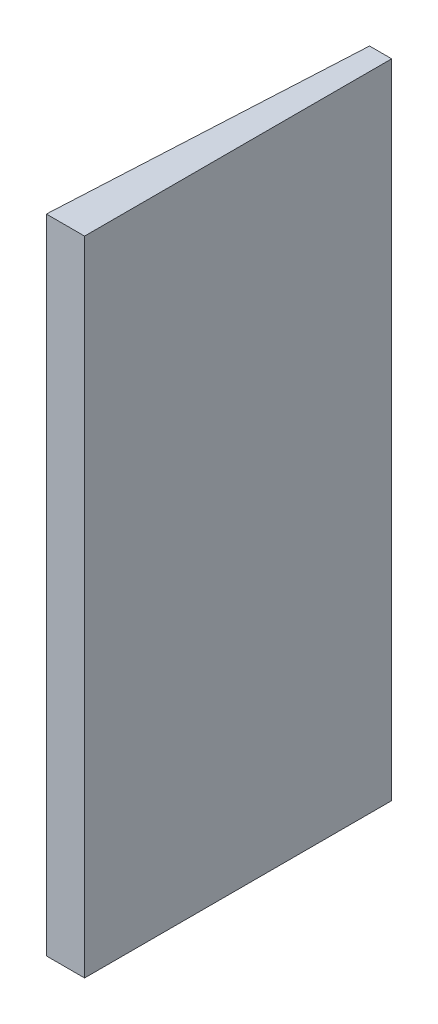
from build123d import *

# Parameters (mm, degrees)
BOSS_EXTRUDE1_DEPTH = 42
SKETCH3_7_R         = 3.3
SKETCH2_6_R         = 6.3


with BuildPart() as part:
    # Sketch1 → Boss-Extrude1 (new, symmetric)
    with BuildSketch(Plane(origin=(0, 0, 0), x_dir=(1, 0, 0), z_dir=(0, 1, 0))):
        Polygon((0, 20.057673142), (0, -20.092326858), (-5, -20.092326858), (-2.895827662, 20.057673142), align=None)
    extrude(amount=BOSS_EXTRUDE1_DEPTH, both=True)

    # Loft2: read off the stored shape, not the designer's step
    # Loft2: loft between two sections, ruled curve by curve
    loft2_from = [
        Edge.make_bspline([(-6.744919191, -26.766256905, -3.934599382), (-7.072478945, -28.860904588, 2.315613069), (-6.962853556, -35.119694494, 0.223836028), (-6.635293801, -33.025046811, -6.026376424), (-6.307734047, -30.930399127, -12.276588875), (-6.417359436, -24.671609222, -10.184811834), (-6.744919191, -26.766256905, -3.934599382)], [0, 0, 0, 0, 0.5, 0.5, 0.5, 1, 1, 1, 1], 3, [1, 0.333333333, 0.333333333, 1, 0.333333333, 0.333333333, 1]),
    ]
    loft2_to = [
        Edge.make_bspline([(-3.874025978, -24.614903671, -1.39253736), (-4.42677199, -31.486205901, 9.154484851), (-4.067155817, -42.047702275, 2.292599502), (-3.514409805, -35.176400045, -8.254422709), (-2.961663793, -28.305097815, -18.801444919), (-3.321279966, -17.743601441, -11.93955957), (-3.874025978, -24.614903671, -1.39253736)], [0, 0, 0, 0, 0.5, 0.5, 0.5, 1, 1, 1, 1], 3, [1, 0.333333333, 0.333333333, 1, 0.333333333, 0.333333333, 1]),
    ]
    loft2 = Solid(Shell([*[Face.make_surface_from_curves(loft2_from[k], loft2_to[k]) for k in range(1)], Face(Wire(loft2_from)), Face(Wire(loft2_to))]))
    add(loft2)

    # Sketch3<7> → Loft3 section 0
    with BuildSketch(Plane(origin=(-6.932083318, 0, -0.363295092), x_dir=(-0.052335956242940435, 0, 0.998629534754574), z_dir=(-0.9986295347545742, 0, -0.052335956242940435))):
        with Locations((-4.623529197, 29.895651858)):
            Circle(SKETCH3_7_R)
    # Sketch2<6> → Loft3 section 1
    with BuildSketch(Plane(origin=(-3.936194713, 0, -0.206287224), x_dir=(-0.052335956242940435, 0, 0.998629534754574), z_dir=(-0.9986295347545742, 0, -0.052335956242940435))):
        with Locations((-4.623529197, 29.895651858)):
            Circle(SKETCH2_6_R)
    loft()


solid = part.part
